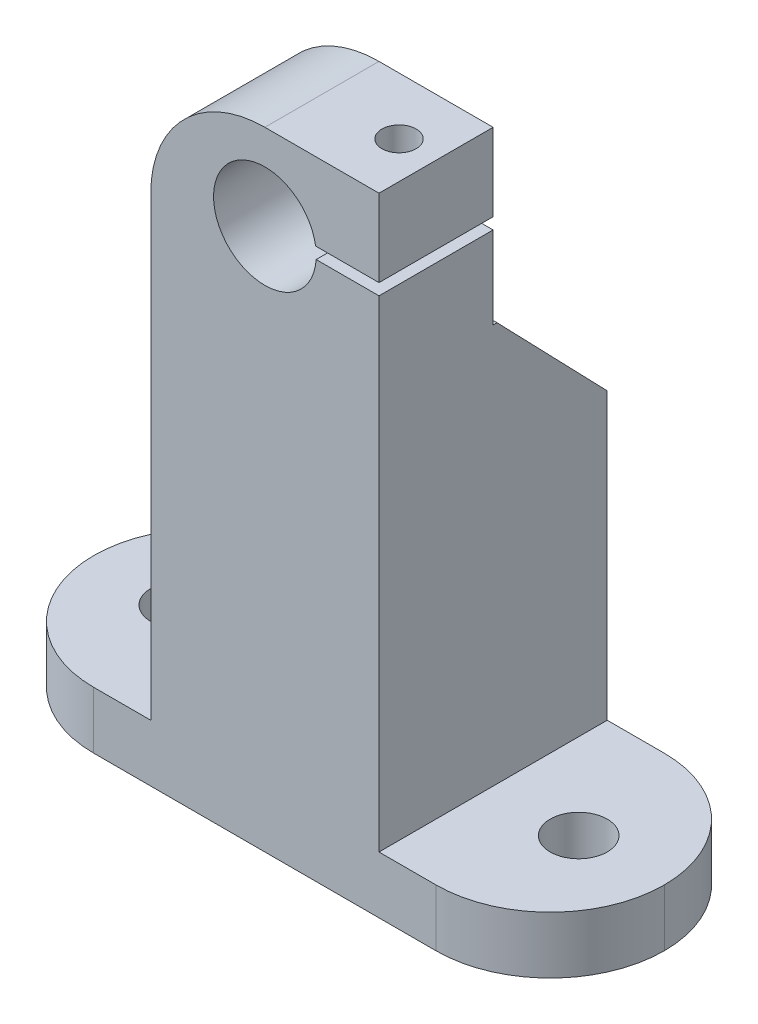
from build123d import *

# Parameters (mm, degrees)
ESQUISSE2_W             = 20
ESQUISSE2_H             = 40
BOSS_EXTRU_2_DEPTH      = 20
BOSS_EXTRU_3_DEPTH      = 10
ESQUISSE6_W             = 50
ESQUISSE6_H             = 20
ESQUISSE6_R             = 2.5
BOSS_EXTRU_4_DEPTH      = 5
ESQUISSE8_R             = 1.5
ENL_V_MAT_EXTRU_1_DEPTH = 40
CONG_2_R                = 10
CONG_3_R                = 10
CHANFREIN2_SIZE         = 10
CHANFREIN2_SIZE2        = 9.656887748


with BuildPart() as part:
    # Esquisse2 → Boss.-Extru.2 (new body)
    with BuildSketch(Plane.XY):
        with Locations((10, -20)):
            Rectangle(ESQUISSE2_W, ESQUISSE2_H)
    extrude(amount=BOSS_EXTRU_2_DEPTH)

    # Esquisse3 → Boss.-Extru.3 (add)
    with BuildSketch(Plane.XY.offset(20)):
        with BuildLine():
            Line((0, 15), (0, 0))
            Line((0, 0), (20, 0))
            Line((20, 0), (20, 7.210541204))
            Line((20, 7.210541204), (14.490680751, 7.210541204))
            ThreePointArc((14.490680751, 7.210541204), (5.50498976, 7.288144059), (14.443549392, 8.210541204))
            Line((14.443549392, 8.210541204), (20, 8.210541204))
            Line((20, 8.210541204), (20, 15))
            Line((20, 15), (0, 15))
        make_face()
    extrude(amount=-BOSS_EXTRU_3_DEPTH)

    # Esquisse6 → Boss.-Extru.4 (add)
    with BuildSketch(Plane.XZ.offset(40)):
        with Locations((10, 10)):
            Rectangle(ESQUISSE6_W, ESQUISSE6_H)
        with Locations(Location((-7.5, 10, 0), (0, 0, 270))):
            Circle(ESQUISSE6_R, mode=Mode.SUBTRACT)
        with Locations(Location((27.5, 10, 0), (0, 0, 270))):
            Circle(ESQUISSE6_R, mode=Mode.SUBTRACT)
    extrude(amount=-BOSS_EXTRU_4_DEPTH)

    # Esquisse8 → Enlèv. mat.-Extru.1 (cut)
    with BuildSketch(Plane(origin=(0, 15, 0), x_dir=(1, 0, 0), z_dir=(0, 1, 0))):
        with Locations(Location((16.757752744, -15, 0), (0, 0, 270))):
            Circle(ESQUISSE8_R)
    extrude(amount=-ENL_V_MAT_EXTRU_1_DEPTH, mode=Mode.SUBTRACT)

    # Congé2
    cong_2_edges = [part.edges().sort_by_distance(p)[0] for p in [
        (0, 15, 15),
    ]]
    fillet(cong_2_edges, radius=CONG_2_R)

    # Congé3
    cong_3_edges = [part.edges().sort_by_distance(p)[0] for p in [
        (-15, -37.5, 0),
        (-15, -37.5, 20),
        (35, -37.5, 20),
        (35, -37.5, 0),
    ]]
    fillet(cong_3_edges, radius=CONG_3_R - 0.0001)  # a hair under: the kernel refuses the full size

    # Chanfrein2
    chanfrein2_edges = [part.edges().sort_by_distance(p)[0] for p in [
        (10, 0, 0),
    ]]
    chanfrein2_side = [part.faces().sort_by_distance(p)[0] for p in [
        (10, -21.029431142, 0),
    ]]
    chamfer(chanfrein2_edges, length=CHANFREIN2_SIZE, length2=CHANFREIN2_SIZE2, reference=chanfrein2_side[0])


solid = part.part
